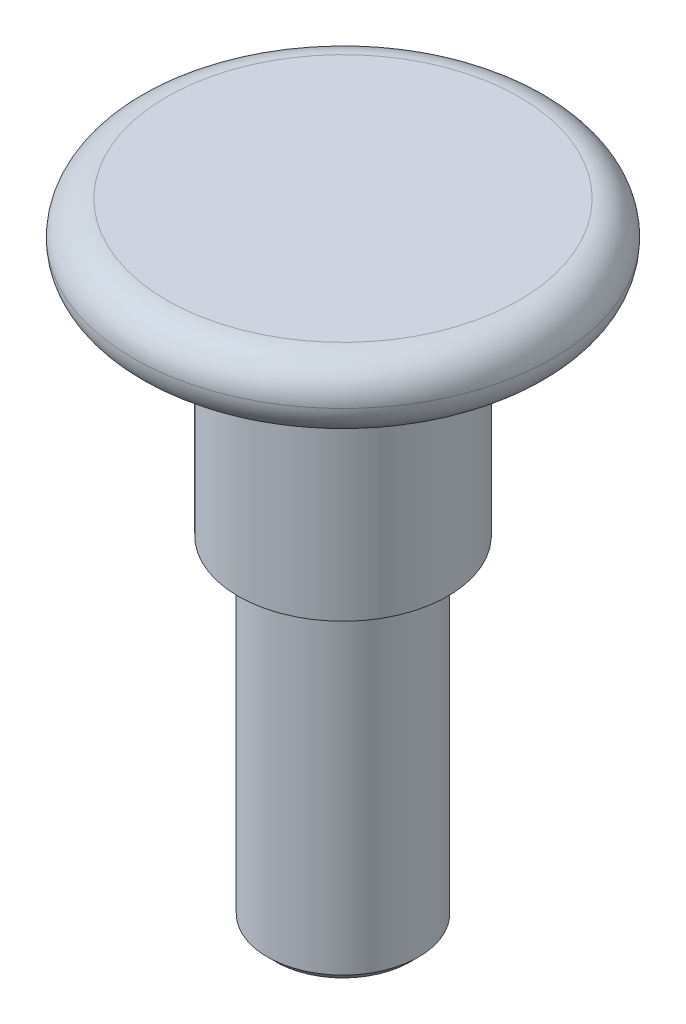
from build123d import *

# Parameters (mm, degrees)
FILETE2_R     = 2
CHANFRO1_SIZE = 0.5


with BuildPart() as part:
    # Esboço1 → Revolução1 (revolve)
    with BuildSketch(Plane.XY, mode=Mode.PRIVATE) as revolu_o1_sk:
        Polygon((0, 56.545238095), (12.5, 56.545238095), (12.5, 52.545238095), (6.25, 52.545238095), (6.25, 39.145238095), (4.5, 39.145238095), (4.5, 19.145238095), (0, 19.145238095), align=None)
    revolve(revolu_o1_sk.sketch.rotate(Axis((0, -62.761627907, 0), (0, 1, 0)), 90), axis=Axis((0, -62.761627907, 0), (0, 1, 0)))

    # Filete2
    filete2_edges = [part.edges().sort_by_distance(p)[0] for p in [
        (0, 52.545238095, 12.5),
        (0, 56.545238095, 12.5),
    ]]
    fillet(filete2_edges, radius=FILETE2_R - 0.0001)  # a hair under: the kernel refuses the full size

    # Chanfro1
    chanfro1_edges = [part.edges().sort_by_distance(p)[0] for p in [
        (0, 19.145238095, 4.5),
    ]]
    chamfer(chanfro1_edges, length=CHANFRO1_SIZE)


solid = part.part
